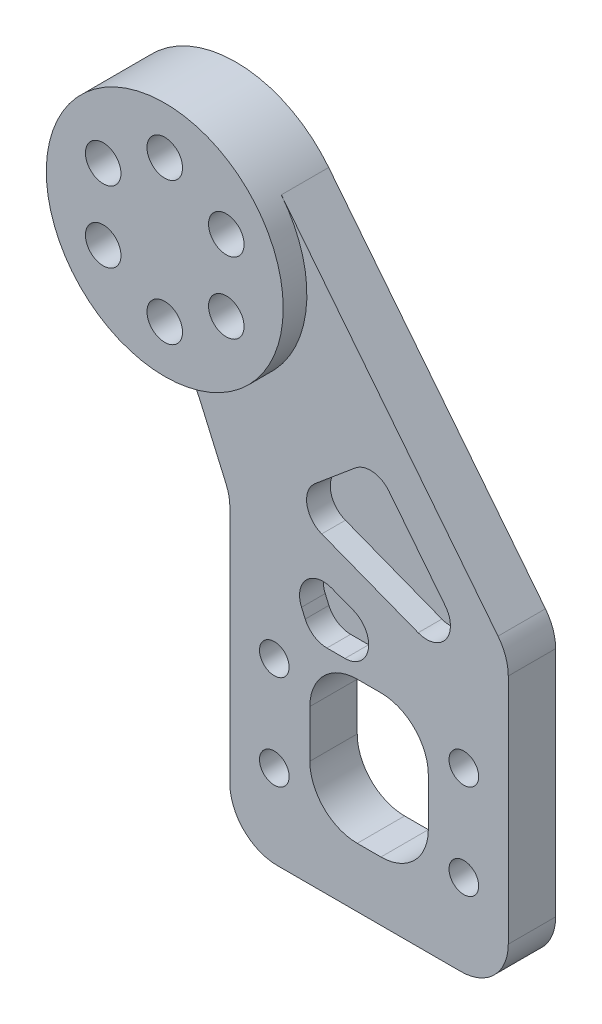
from build123d import *
from build123d.topology import SkipClean

# Parameters (mm, degrees)
SKETCH_1_R          = 10
SKETCH_1_W          = 23.5
SKETCH_1_H          = 33
SKETCH_1_R_2        = 1.25
EXTRUDE_1_DEPTH     = 4
SKETCH_2_R          = 10
EXTRUDE_2_DEPTH     = 2
SKETCH_3_R          = 1.5
CUT_EXTRUDE_1_DEPTH = 6
SKETCH_4_W          = 10
SKETCH_4_H          = 12
CUT_EXTRUDE_2_DEPTH = 6
CUT_EXTRUDE_START   = -10
CUT_EXTRUDE_4_DEPTH = 10
EXTRUDE_4_DEPTH     = 4
FILLET_1_R          = 4
CUT_EXTRUDE_5_DEPTH = 2
FILLET_2_R          = 2
FILLET_3_R          = 4


with BuildPart() as part:
    # 草图1 → 凸台-拉伸1 (new body)
    # profile 1 of 3: a face of its own
    with BuildSketch(Plane.XY):
        with Locations((-15.25, 26.5)):
            Circle(SKETCH_1_R)
    # profile 2 of 3: a face of its own
    with BuildSketch(Plane.XY):
        with BuildLine():
            Line((-15.25, 16.5), (-11.75, 16.5))
            Line((-11.75, 16.5), (11.75, 16.5))
            Line((11.75, 16.5), (-8.736127865, 34.087454765))
            ThreePointArc((-8.736127865, 34.087454765), (-6.16323156, 30.675001716), (-5.25, 26.5))
            ThreePointArc((-5.25, 26.5), (-8.178932188, 19.428932188), (-15.25, 16.5))
        make_face()
    # profile 3 of 3: a face of its own
    with BuildSketch(Plane.XY):
        Rectangle(SKETCH_1_W, SKETCH_1_H)
        with Locations((-8, -1.5)):
            Circle(SKETCH_1_R_2, mode=Mode.SUBTRACT)
        with Locations((-8, -9.5)):
            Circle(SKETCH_1_R_2, mode=Mode.SUBTRACT)
        with Locations((8, -9.5)):
            Circle(SKETCH_1_R_2, mode=Mode.SUBTRACT)
        with Locations((8, -1.5)):
            Circle(SKETCH_1_R_2, mode=Mode.SUBTRACT)
    extrude(amount=EXTRUDE_1_DEPTH)

    # 草图2 → 凸台-拉伸2 (add)
    with BuildSketch(Plane.XY.offset(4)):
        with Locations(Location((-15.25, 26.5, 0), (0, 0, 270))):
            Circle(SKETCH_2_R)
    extrude(amount=EXTRUDE_2_DEPTH)

    # 草图3 → 切除-拉伸1 (cut)
    with BuildSketch(Plane.XY.offset(6)):
        with Locations((-15.25, 32.5)):
            Circle(SKETCH_3_R)
        with Locations((-10.053847577, 29.5)):
            Circle(SKETCH_3_R)
        with Locations((-10.053847577, 23.5)):
            Circle(SKETCH_3_R)
        with Locations((-15.25, 20.5)):
            Circle(SKETCH_3_R)
        with Locations((-20.446152423, 23.5)):
            Circle(SKETCH_3_R)
        with Locations((-20.446152423, 29.5)):
            Circle(SKETCH_3_R)
    extrude(amount=-CUT_EXTRUDE_1_DEPTH, mode=Mode.SUBTRACT)

    # 草图4 → 切除-拉伸2 (cut)
    with BuildSketch(Plane.XY.offset(4)):
        with Locations((0, -5.5)):
            Rectangle(SKETCH_4_W, SKETCH_4_H)
    extrude(amount=-CUT_EXTRUDE_2_DEPTH, mode=Mode.SUBTRACT)

    # 草图7 → 切除-拉伸4 (cut)
    with SkipClean():  # the faces are left unmerged after this step: merging them gives an invalid solid
        with BuildSketch(Plane.XY.offset(4).offset(CUT_EXTRUDE_START)):
            with BuildLine():
                Line((-7.408855029, 32.706161901), (11.75, 8.5))
                Line((11.75, 8.5), (11.75, 16.5))
                Line((11.75, 16.5), (-8.736127865, 34.087454765))
                ThreePointArc((-8.736127865, 34.087454765), (-8.03933973, 33.428663542), (-7.408855029, 32.706161901))
            make_face()
        extrude(amount=CUT_EXTRUDE_4_DEPTH, mode=Mode.SUBTRACT)

    # 草图8 → 凸台-拉伸4 (add)
    with SkipClean():  # the faces are left unmerged after this step: merging them gives an invalid solid
        with BuildSketch(Plane.XY.offset(4)):
            Polygon((-15.25, 16.5), (-11.75, 8.5), (-11.75, 16.5), align=None)
        extrude(amount=-EXTRUDE_4_DEPTH)

    # 圆角1
    # the kernel refuses this fillet: 4 mm, written as the material it adds along each edge
    with BuildSketch(Plane(origin=(-11.75, 8.5, 4), x_dir=(-0.4008188340197085, 0.9161573349021888, 0), z_dir=(0, 0, -1))) as fillet_1_piece_1:
        with BuildLine():
            CenterArc((FILLET_1_R * 0.209178456653, -FILLET_1_R), FILLET_1_R, 90, 23.629377731)
            Line((-FILLET_1_R * 0.191640377366, -FILLET_1_R * 0.0838426650978), (0, 0))
            Line((0, 0), (FILLET_1_R * 0.209178456653, 0))
        make_face()
    extrude(amount=4)
    with BuildSketch(Plane(origin=(-15.25, 16.5, 0), x_dir=(-0.9951749946983144, 0.09811590048106404, 0), z_dir=(0, 0, 1))) as fillet_1_piece_2:
        with BuildLine():
            CenterArc((2.354781612, 3.980699979), FILLET_1_R, 209.260063678, 55.109250376)
            Line((-1.134859069, 2.025602047), (0, 0))
            ThreePointArc((0, 0), (0.981159005, 0.048250053), (1.96231801, 0))
        make_face()
    extrude(amount=4)
    # the kernel refuses this fillet: 4 mm, written as the material it takes off along each edge
    with BuildSketch(Plane(origin=(11.75, -16.5, -10), x_dir=(0, 1, 0), z_dir=(0, 0, 1)), Plane(origin=(-11.75, -16.5, -10), x_dir=(1, 0, 0), z_dir=(0, 0, 1))) as fillet_1_2_piece_1:
        with BuildLine():
            CenterArc((FILLET_1_R, FILLET_1_R), FILLET_1_R, 180, 90)
            Line((0, FILLET_1_R), (0, 0))
            Line((0, 0), (FILLET_1_R, 0))
        make_face()
    extrude(amount=24, mode=Mode.SUBTRACT)
    with BuildSketch(Plane(origin=(11.75, 8.5, -3.478567049), x_dir=(-0.6206161901076825, 0.7841144971088245, 0), z_dir=(0, 0, 1))) as fillet_1_2_piece_2:
        with BuildLine():
            CenterArc((FILLET_1_R * 0.347856704888, FILLET_1_R), FILLET_1_R, 231.638854085, 38.361145915)
            Line((-FILLET_1_R * 0.272759485219, FILLET_1_R * 0.215885502891), (0, 0))
            Line((0, 0), (FILLET_1_R * 0.347856704888, 0))
        make_face()
    extrude(amount=10.957134098, mode=Mode.SUBTRACT)

    # 草图9 → 切除-拉伸5 (cut)
    with BuildSketch(Plane.XY.offset(4)):
        Polygon((-7.627398855, 7.809036267), (-4.867195488, 1.5), (8.671465121, 1.5), align=None)
        Polygon((-7.160168155, 10.845088414), (10.991392982, 3.818901946), (0.414449212, 17.182289942), align=None)
    extrude(amount=-CUT_EXTRUDE_5_DEPTH, mode=Mode.SUBTRACT)

    # 圆角2
    fillet_2_edges = [part.edges().sort_by_distance(p)[0] for p in [
        (-7.160168155, 10.845088414, 3),
        (0.414449212, 17.182289942, 3),
        (10.991392982, 3.818901946, 3),
        (8.671465121, 1.5, 3),
        (-4.867195488, 1.5, 3),
        (-7.627398855, 7.809036267, 3),
    ]]
    fillet(fillet_2_edges, radius=FILLET_2_R)

    # 圆角3
    fillet_3_edges = [part.edges().sort_by_distance(p)[0] for p in [
        (5, 0.5, 2),
        (5, -11.5, 2),
        (-5, -11.5, 2),
        (-5, 0.5, 2),
    ]]
    fillet(fillet_3_edges, radius=FILLET_3_R)


solid = part.part
